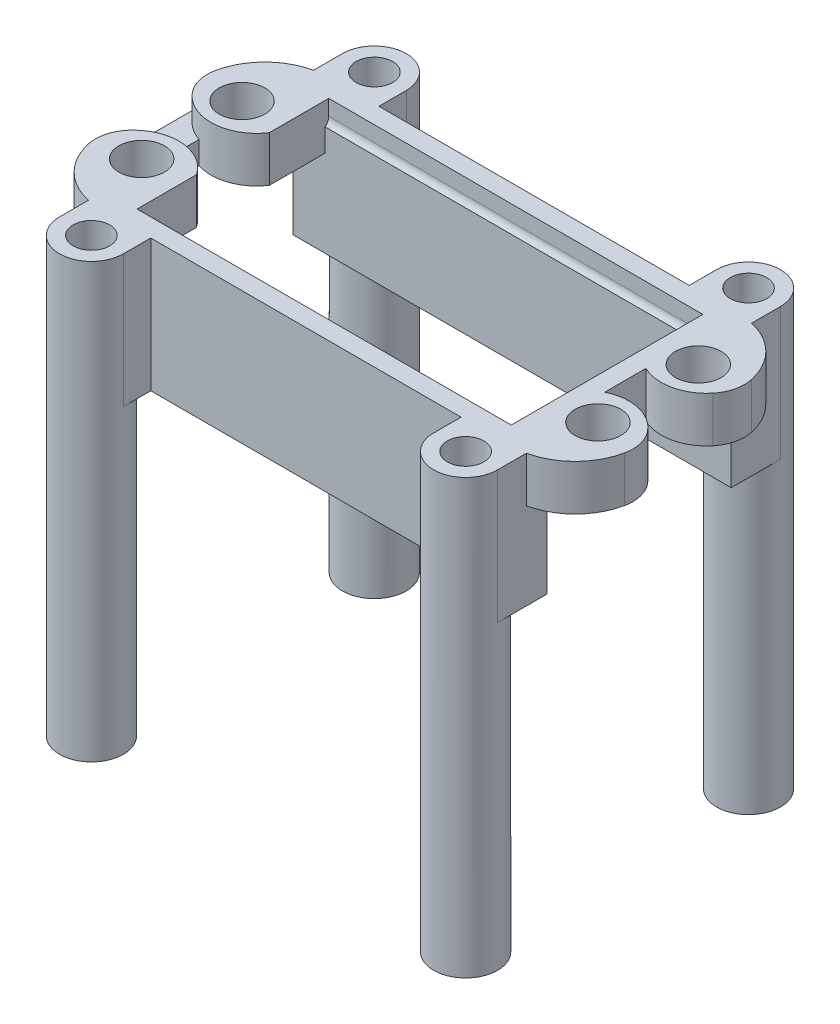
from build123d import *

# Parameters (mm, degrees)
SKETCH1_R           = 2.5
BOSS_EXTRUDE1_DEPTH = 2.5
BOSS_EXTRUDE2_START = -45
SKETCH4_R           = 3.5
SKETCH4_R_2         = 2
BOSS_EXTRUDE2_DEPTH = 47.5
BOSS_EXTRUDE3_START = -2.5
SKETCH5_R           = 2.5
BOSS_EXTRUDE3_DEPTH = 2.5
BOSS_EXTRUDE4_START = -12
BOSS_EXTRUDE4_DEPTH = 12
BOSS_EXTRUDE5_DEPTH = 2.5
FILLET2_R           = 1
FILLET3_R           = 1


with BuildPart() as part:
    # Sketch1 → Boss-Extrude1 (new body)
    with BuildSketch(Plane(origin=(0, 0, 0), x_dir=(1, 0, 0), z_dir=(0, 1, 0))):
        with BuildLine():
            Line((20.5, 10.5), (-20.5, 10.5))
            Line((-20.5, 10.5), (-20.5, 4))
            ThreePointArc((-20.5, 4), (-24.40287122, 1.76806345), (-28.520566145, 3.573204173))
            ThreePointArc((-28.520566145, 3.573204173), (-29.324072849, 5.171652721), (-29.350396575, 6.960498116))
            ThreePointArc((-29.350396575, 6.960498116), (-26.904940816, 10.941842627), (-22.5, 12.5))
            Line((-22.5, 12.5), (22.5, 12.5))
            ThreePointArc((22.5, 12.5), (26.904940816, 10.941842627), (29.350396575, 6.960498116))
            ThreePointArc((29.350396575, 6.960498116), (29.324072849, 5.171652721), (28.520566145, 3.573204173))
            ThreePointArc((28.520566145, 3.573204173), (25.737402548, 1.876578025), (22.5, 2.2557411))
            Line((22.5, 2.2557411), (22.5, -2.2557411))
            ThreePointArc((22.5, -2.2557411), (25.737402548, -1.876578025), (28.520566145, -3.573204173))
            ThreePointArc((28.520566145, -3.573204173), (29.324072849, -5.171652721), (29.350396575, -6.960498116))
            ThreePointArc((29.350396575, -6.960498116), (26.904940816, -10.941842627), (22.5, -12.5))
            Line((22.5, -12.5), (-22.5, -12.5))
            ThreePointArc((-22.5, -12.5), (-26.904940816, -10.941842627), (-29.350396575, -6.960498116))
            ThreePointArc((-29.350396575, -6.960498116), (-29.324072849, -5.171652721), (-28.520566145, -3.573204173))
            ThreePointArc((-28.520566145, -3.573204173), (-24.40287122, -1.76806345), (-20.5, -4))
            Line((-20.5, -4), (-20.5, -10.5))
            Line((-20.5, -10.5), (20.5, -10.5))
            Line((20.5, -10.5), (20.5, 10.5))
        make_face()
        with Locations(Location((-25, 5.5, 0), (0, 0, 270))):
            Circle(SKETCH1_R, mode=Mode.SUBTRACT)
        with Locations(Location((-25, -5.5, 0), (0, 0, 270))):
            Circle(SKETCH1_R, mode=Mode.SUBTRACT)
        with Locations(Location((25, -5.5, 0), (0, 0, 90))):
            Circle(SKETCH1_R, mode=Mode.SUBTRACT)
        with Locations(Location((25, 5.5, 0), (0, 0, 90))):
            Circle(SKETCH1_R, mode=Mode.SUBTRACT)
    extrude(amount=BOSS_EXTRUDE1_DEPTH)

    # Sketch4 → Boss-Extrude2 (add)
    # profile 1 of 4: a face of its own
    with BuildSketch(Plane(origin=(0, 0, 0), x_dir=(1, 0, 0), z_dir=(0, 1, 0)).offset(BOSS_EXTRUDE2_START)):
        with Locations(Location((-20.5, 15.5, 0), (0, 0, 270))):
            Circle(SKETCH4_R)
        with Locations(Location((-20.5, 15.5, 0), (0, 0, 270))):
            Circle(SKETCH4_R_2, mode=Mode.SUBTRACT)
    # profile 2 of 4: a face of its own
    with BuildSketch(Plane(origin=(0, 0, 0), x_dir=(1, 0, 0), z_dir=(0, 1, 0)).offset(BOSS_EXTRUDE2_START)):
        with Locations(Location((20.5, 15.5, 0), (0, 0, 270))):
            Circle(SKETCH4_R)
        with Locations(Location((20.5, 15.5, 0), (0, 0, 270))):
            Circle(SKETCH4_R_2, mode=Mode.SUBTRACT)
    # profile 3 of 4: a face of its own
    with BuildSketch(Plane(origin=(0, 0, 0), x_dir=(1, 0, 0), z_dir=(0, 1, 0)).offset(BOSS_EXTRUDE2_START)):
        with Locations(Location((-20.5, -15.5, 0), (0, 0, 270))):
            Circle(SKETCH4_R)
        with Locations(Location((-20.5, -15.5, 0), (0, 0, 270))):
            Circle(SKETCH4_R_2, mode=Mode.SUBTRACT)
    # profile 4 of 4: a face of its own
    with BuildSketch(Plane(origin=(0, 0, 0), x_dir=(1, 0, 0), z_dir=(0, 1, 0)).offset(BOSS_EXTRUDE2_START)):
        with Locations(Location((20.5, -15.5, 0), (0, 0, 270))):
            Circle(SKETCH4_R)
        with Locations(Location((20.5, -15.5, 0), (0, 0, 270))):
            Circle(SKETCH4_R_2, mode=Mode.SUBTRACT)
    extrude(amount=BOSS_EXTRUDE2_DEPTH)

    # Sketch5 → Boss-Extrude3 (add)
    with BuildSketch(Plane(origin=(0, 0, 0), x_dir=(1, 0, 0), z_dir=(0, 1, 0)).offset(BOSS_EXTRUDE3_START)):
        with BuildLine():
            Line((-29.324072849, 5.171652721), (-29.324072849, -5.171652721))
            ThreePointArc((-29.324072849, -5.171652721), (-29.438527194, -6.064584851), (-29.350396575, -6.960498116))
            ThreePointArc((-29.350396575, -6.960498116), (-27.465923203, -10.435821373), (-24, -12.337527971))
            Line((-24, -12.337527971), (-24, -15.5))
            Line((-24, -15.5), (-22.5, -15.5))
            ThreePointArc((-22.5, -15.5), (-20.5, -13.5), (-18.5, -15.5))
            Line((-18.5, -15.5), (-17, -15.5))
            Line((-17, -15.5), (-17, -12.5))
            Line((-17, -12.5), (17, -12.5))
            Line((17, -12.5), (17, -15.5))
            Line((17, -15.5), (18.5, -15.5))
            ThreePointArc((18.5, -15.5), (20.5, -13.5), (22.5, -15.5))
            Line((22.5, -15.5), (24, -15.5))
            Line((24, -15.5), (24, -12.337527971))
            ThreePointArc((24, -12.337527971), (27.465923203, -10.435821373), (29.350396575, -6.960498116))
            ThreePointArc((29.350396575, -6.960498116), (29.324072849, -5.171652721), (28.520566145, -3.573204173))
            ThreePointArc((28.520566145, -3.573204173), (25.737402548, -1.876578025), (22.5, -2.2557411))
            Line((22.5, -2.2557411), (22.5, 2.2557411))
            ThreePointArc((22.5, 2.2557411), (25.737402548, 1.876578025), (28.520566145, 3.573204173))
            ThreePointArc((28.520566145, 3.573204173), (29.324072849, 5.171652721), (29.350396575, 6.960498116))
            ThreePointArc((29.350396575, 6.960498116), (27.465923203, 10.435821373), (24, 12.337527971))
            Line((24, 12.337527971), (24, 15.5))
            Line((24, 15.5), (22.5, 15.5))
            ThreePointArc((22.5, 15.5), (20.5, 13.5), (18.5, 15.5))
            Line((18.5, 15.5), (17, 15.5))
            Line((17, 15.5), (17, 12.5))
            Line((17, 12.5), (-17, 12.5))
            Line((-17, 12.5), (-17, 15.5))
            Line((-17, 15.5), (-18.5, 15.5))
            ThreePointArc((-18.5, 15.5), (-20.5, 13.5), (-22.5, 15.5))
            Line((-22.5, 15.5), (-24, 15.5))
            Line((-24, 15.5), (-24, 12.337527971))
            ThreePointArc((-24, 12.337527971), (-27.465923203, 10.435821373), (-29.350396575, 6.960498116))
            ThreePointArc((-29.350396575, 6.960498116), (-29.438527194, 6.064584851), (-29.324072849, 5.171652721))
        make_face()
        with Locations(Location((-25, 5.5, 0), (0, 0, 270))):
            Circle(SKETCH5_R, mode=Mode.SUBTRACT)
        with Locations(Location((-25, -5.5, 0), (0, 0, 270))):
            Circle(SKETCH5_R, mode=Mode.SUBTRACT)
        with Locations(Location((25, -5.5, 0), (0, 0, 90))):
            Circle(SKETCH5_R, mode=Mode.SUBTRACT)
        with Locations(Location((25, 5.5, 0), (0, 0, 90))):
            Circle(SKETCH5_R, mode=Mode.SUBTRACT)
        with BuildLine():
            Line((-26.208643878, 2.004095257), (-26.208643878, -2.004095257))
            ThreePointArc((-26.208643878, -2.004095257), (-23.018368657, -2.041161266), (-20.5, -4))
            Line((-20.5, -4), (-20.5, -10.5))
            Line((-20.5, -10.5), (20.5, -10.5))
            Line((20.5, -10.5), (20.5, 10.5))
            Line((20.5, 10.5), (-20.5, 10.5))
            Line((-20.5, 10.5), (-20.5, 4))
            ThreePointArc((-20.5, 4), (-23.018368657, 2.041161266), (-26.208643878, 2.004095257))
        make_face(mode=Mode.SUBTRACT)
    extrude(amount=BOSS_EXTRUDE3_DEPTH)

    # Sketch6 → Boss-Extrude4 (add)
    with BuildSketch(Plane(origin=(0, 0, 0), x_dir=(1, 0, 0), z_dir=(0, 1, 0)).offset(BOSS_EXTRUDE4_START)):
        with BuildLine():
            Line((-24, 15.5), (-22.5, 15.5))
            ThreePointArc((-22.5, 15.5), (-20.5, 13.5), (-18.5, 15.5))
            Line((-18.5, 15.5), (-17, 15.5))
            Line((-17, 15.5), (-17, 12.5))
            Line((-17, 12.5), (17, 12.5))
            Line((17, 12.5), (17, 15.5))
            Line((17, 15.5), (18.5, 15.5))
            ThreePointArc((18.5, 15.5), (20.5, 13.5), (22.5, 15.5))
            Line((22.5, 15.5), (24, 15.5))
            Line((24, 15.5), (24, 10.1))
            Line((24, 10.1), (-24, 10.1))
            Line((-24, 10.1), (-24, 15.5))
        make_face()
        with BuildLine():
            Line((24, -15.5), (24, -10.1))
            Line((24, -10.1), (-24, -10.1))
            Line((-24, -10.1), (-24, -15.5))
            Line((-24, -15.5), (-22.5, -15.5))
            ThreePointArc((-22.5, -15.5), (-20.5, -13.5), (-18.5, -15.5))
            Line((-18.5, -15.5), (-17, -15.5))
            Line((-17, -15.5), (-17, -12.5))
            Line((-17, -12.5), (17, -12.5))
            Line((17, -12.5), (17, -15.5))
            Line((17, -15.5), (18.5, -15.5))
            ThreePointArc((18.5, -15.5), (20.5, -13.5), (22.5, -15.5))
            Line((22.5, -15.5), (24, -15.5))
        make_face()
    extrude(amount=BOSS_EXTRUDE4_DEPTH)

    # Sketch7 → Boss-Extrude5 (add)
    with BuildSketch(Plane(origin=(0, 0, 0), x_dir=(1, 0, 0), z_dir=(0, 1, 0))):
        with BuildLine():
            Line((-24, -15.5), (-24, -10.98088563))
            Line((-24, -10.98088563), (-17, -10.98088563))
            Line((-17, -10.98088563), (-17, -15.5))
            ThreePointArc((-17, -15.5), (-20.5, -12), (-24, -15.5))
        make_face()
        with BuildLine():
            Line((17, -15.5), (17, -10.98088563))
            Line((17, -10.98088563), (24, -10.98088563))
            Line((24, -10.98088563), (24, -15.5))
            ThreePointArc((24, -15.5), (20.5, -12), (17, -15.5))
        make_face()
        with BuildLine():
            Line((24, 10.98088563), (24, 15.5))
            ThreePointArc((24, 15.5), (20.5, 12), (17, 15.5))
            Line((17, 15.5), (17, 10.98088563))
            Line((17, 10.98088563), (24, 10.98088563))
        make_face()
        with BuildLine():
            Line((-24, 10.98088563), (-17, 10.98088563))
            Line((-17, 10.98088563), (-17, 15.5))
            ThreePointArc((-17, 15.5), (-20.5, 12), (-24, 15.5))
            Line((-24, 15.5), (-24, 10.98088563))
        make_face()
    extrude(amount=BOSS_EXTRUDE5_DEPTH)

    # Fillet2
    # the kernel refuses this fillet: 1 mm, written as the material it adds along each edge
    with BuildSketch(Plane(origin=(-22.5, 0, -10.5), x_dir=(0, 1, 0), z_dir=(1, 0, 0))) as fillet2_piece_1:
        with BuildLine():
            CenterArc((0.8, 1), FILLET2_R, 216.869897646, 53.130102354)
            Line((0, 0.4), (-0.016, 0.388))
            ThreePointArc((-0.016, 0.388), (-0.02, 0.2), (-0.02, 0))
            Line((-0.02, 0), (0, -0.02))
            Line((0, -0.02), (0.8, -0.02))
            Line((0.8, -0.02), (0.8, 0))
        make_face()
    extrude(amount=45)

    # Fillet3
    # the kernel refuses this fillet: 1 mm, written as the material it adds along each edge
    with BuildSketch(Plane(origin=(-22.5, 0, 10.5), x_dir=(0, 0, -1), z_dir=(1, 0, 0))) as fillet3_piece_1:
        with BuildLine():
            CenterArc((1, 0.8), FILLET3_R, 180, 53.130102354)
            Line((0, 0.8), (-0.02, 0.8))
            Line((-0.02, 0.8), (-0.02, 0))
            Line((-0.02, 0), (0, -0.02))
            ThreePointArc((0, -0.02), (0.2, -0.02), (0.388, -0.016))
            Line((0.388, -0.016), (0.4, 0))
        make_face()
    extrude(amount=45)


solid = part.part
